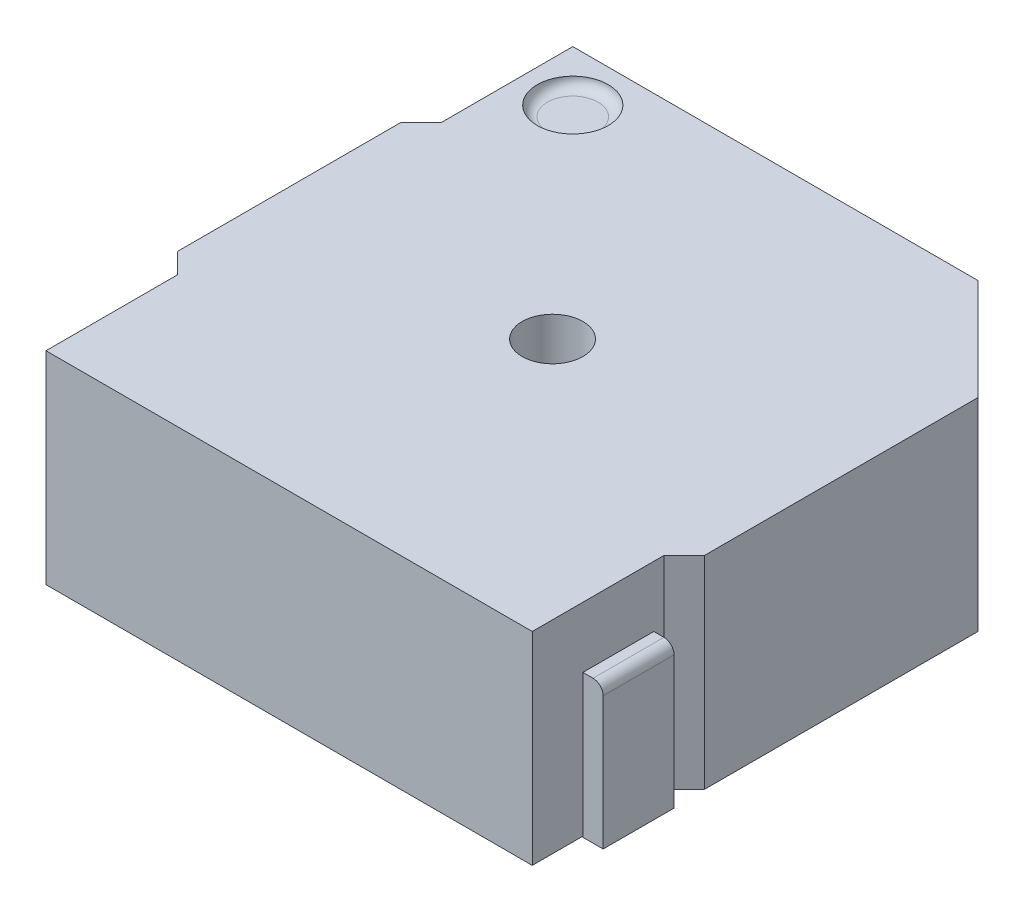
from build123d import *

# Parameters (mm, degrees)
SKETCH_1_W             = 5.2
SKETCH_1_H             = 5.2
EXTRUDE_1_DEPTH        = 2
SKETCH_2_W             = 0.2
SKETCH_2_H             = 1.5
CUT_EXTRUDE_1_DEPTH    = 5.185689907
CHAMFER_1_SIZE         = 0.2
CHAMFER_2_SIZE         = 1
SKETCH_3_R             = 0.3
CUT_EXTRUDE_2_DEPTH    = 1
SKETCH_4_R             = 0.3
EXTRUDE_2_DEPTH        = 0.1
SKETCH_5_R             = 0.35
CUT_EXTRUDE_3_DEPTH    = 0.1
FILLET_1_R             = 0.1
EXTRUDE_3_DEPTH        = 0.01
EXTRUDE_3_DEPTH_BACK   = 1.4
SKETCH_6_W             = 0.9
SKETCH_6_H             = 0.7
EXTRUDE_3_2_DEPTH      = 0.01
EXTRUDE_3_2_DEPTH_BACK = 1.4
EXTRUDE_3_3_DEPTH      = 0.01
EXTRUDE_3_3_DEPTH_BACK = 1.4
SKETCH_7_R             = 0.3
CUT_EXTRUDE_4_DEPTH    = 1
SKETCH_8_R             = 0.3
EXTRUDE_4_DEPTH        = 0.1
EXTRUDE_4_2_DEPTH      = 0.1
EXTRUDE_4_3_DEPTH      = 0.1
FILLET_2_R             = 0.1
FILLET_3_R             = 0.1
FILLET_4_R             = 0.1


with BuildPart() as part:
    # 草图1 → 凸台-拉伸1 (new body)
    with BuildSketch(Plane(origin=(0, 0, 0), x_dir=(1, 0, 0), z_dir=(0, 1, 0))):
        Rectangle(SKETCH_1_W, SKETCH_1_H)
    extrude(amount=EXTRUDE_1_DEPTH)

    # 草图2 → 切除-拉伸1 (cut, through all)
    with BuildSketch(Plane(origin=(0, 2, 0), x_dir=(1, 0, 0), z_dir=(0, 1, 0))):
        with Locations((-2.5, -1.85)):
            Rectangle(SKETCH_2_W, SKETCH_2_H)
        with Locations((-2.5, 1.85)):
            Rectangle(SKETCH_2_W, SKETCH_2_H)
        with Locations((2.5, -1.85)):
            Rectangle(SKETCH_2_W, SKETCH_2_H)
    extrude(amount=-CUT_EXTRUDE_1_DEPTH, mode=Mode.SUBTRACT)

    # 倒角1
    chamfer_1_edges = [part.edges().sort_by_distance(p)[0] for p in [
        (2.4, 1, 1.1),
        (-2.4, 1, -1.1),
        (-2.4, 1, 1.1),
    ]]
    chamfer(chamfer_1_edges, length=CHAMFER_1_SIZE - 0.0001)  # a hair under: the kernel refuses the full size

    # 倒角2
    chamfer_2_edges = [part.edges().sort_by_distance(p)[0] for p in [
        (2.6, 1, -2.6),
    ]]
    chamfer(chamfer_2_edges, length=CHAMFER_2_SIZE)

    # 草图3 → 切除-拉伸2 (cut)
    with BuildSketch(Plane(origin=(0, 2, 0), x_dir=(1, 0, 0), z_dir=(0, 1, 0))):
        with Locations(Location((0, 0, 0), (0, 0, 270))):
            Circle(SKETCH_3_R)
    extrude(amount=-CUT_EXTRUDE_2_DEPTH, mode=Mode.SUBTRACT)

    # 草图5 → 切除-拉伸3 (cut)
    with BuildSketch(Plane(origin=(0, 2, 0), x_dir=(1, 0, 0), z_dir=(0, 1, 0))):
        with Locations(Location((-1.9, 2.1, 0), (0, 0, 270))):
            Circle(SKETCH_5_R)
    extrude(amount=-CUT_EXTRUDE_3_DEPTH, mode=Mode.SUBTRACT)

    # 圆角1
    fillet_1_edges = [part.edges().sort_by_distance(p)[0] for p in [
        (-1.9, 1.9, -2.45),
    ]]
    fillet(fillet_1_edges, radius=FILLET_1_R - 0.0001)  # a hair under: the kernel refuses the full size

    # 草图7 → 切除-拉伸4 (cut)
    with BuildSketch(Plane.XZ):
        with Locations(Location((-1.1, 1.75, 0), (0, 0, 270))):
            Circle(SKETCH_7_R)
        with Locations(Location((-1.1, -1.75, 0), (0, 0, 90))):
            Circle(SKETCH_7_R)
        with Locations(Location((1.1, 1.75, 0), (0, 0, 90))):
            Circle(SKETCH_7_R)
    extrude(amount=-CUT_EXTRUDE_4_DEPTH, mode=Mode.SUBTRACT)


with BuildPart() as body_2:
    # 草图4 → 凸台-拉伸2 (new body)
    with BuildSketch(Plane(origin=(0, 1, 0), x_dir=(1, 0, 0), z_dir=(0, 1, 0))):
        with Locations(Location((0, 0, 0), (0, 0, 270))):
            Circle(SKETCH_4_R)
    extrude(amount=EXTRUDE_2_DEPTH)


with BuildPart() as body_3:
    # 草图6 → 凸台-拉伸3 (new, two sides: drawn at the far end of the back side and taken through both)
    with BuildSketch(Plane.XZ.offset(-EXTRUDE_3_DEPTH_BACK)):
        with Locations((2.15, 1.75)):
            Rectangle(SKETCH_6_W, SKETCH_6_H)
    extrude(amount=EXTRUDE_3_DEPTH + EXTRUDE_3_DEPTH_BACK)

    # 圆角4
    fillet_4_edges = [body_3.edges().sort_by_distance(p)[0] for p in [
        (2.6, 1.4, 1.75),
    ]]
    fillet(fillet_4_edges, radius=FILLET_4_R)


with BuildPart() as body_4:
    # 草图6 → Extrude 3 2 (new, two sides: drawn at the far end of the back side and taken through both)
    with BuildSketch(Plane.XZ.offset(-EXTRUDE_3_2_DEPTH_BACK)):
        with Locations((-2.15, 1.75)):
            Rectangle(SKETCH_6_W, SKETCH_6_H)
    extrude(amount=EXTRUDE_3_2_DEPTH + EXTRUDE_3_2_DEPTH_BACK)

    # 圆角3
    fillet_3_edges = [body_4.edges().sort_by_distance(p)[0] for p in [
        (-2.6, 1.4, 1.75),
    ]]
    fillet(fillet_3_edges, radius=FILLET_3_R)


with BuildPart() as body_5:
    # 草图6 → Extrude 3 3 (new, two sides: drawn at the far end of the back side and taken through both)
    with BuildSketch(Plane.XZ.offset(-EXTRUDE_3_3_DEPTH_BACK)):
        with Locations((-2.15, -1.75)):
            Rectangle(SKETCH_6_W, SKETCH_6_H)
    extrude(amount=EXTRUDE_3_3_DEPTH + EXTRUDE_3_3_DEPTH_BACK)

    # 圆角2
    fillet_2_edges = [body_5.edges().sort_by_distance(p)[0] for p in [
        (-2.6, 1.4, -1.75),
    ]]
    fillet(fillet_2_edges, radius=FILLET_2_R)


with BuildPart() as body_6:
    # 草图8 → 凸台-拉伸4 (new body)
    with BuildSketch(Plane.XZ.offset(-1)):
        with Locations(Location((1.1, 1.75, 0), (0, 0, 270))):
            Circle(SKETCH_8_R)
    extrude(amount=EXTRUDE_4_DEPTH)


with BuildPart() as body_7:
    # 草图8 → Extrude 4 2 (new body)
    with BuildSketch(Plane.XZ.offset(-1)):
        with Locations(Location((-1.1, 1.75, 0), (0, 0, 270))):
            Circle(SKETCH_8_R)
    extrude(amount=EXTRUDE_4_2_DEPTH)


with BuildPart() as body_8:
    # 草图8 → Extrude 4 3 (new body)
    with BuildSketch(Plane.XZ.offset(-1)):
        with Locations(Location((-1.1, -1.75, 0), (0, 0, 270))):
            Circle(SKETCH_8_R)
    extrude(amount=EXTRUDE_4_3_DEPTH)


solid = Compound([part.part, body_2.part, body_3.part, body_4.part, body_5.part, body_6.part, body_7.part, body_8.part])
